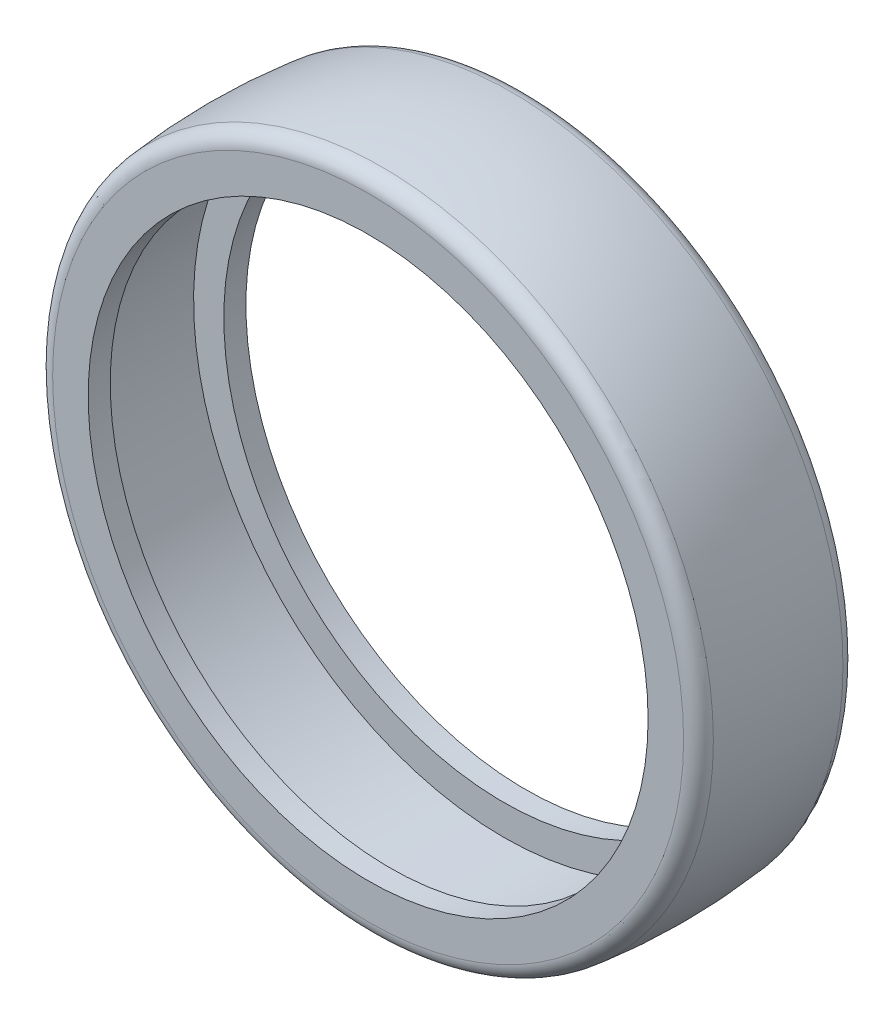
from build123d import *

# Parameters (mm, degrees)
FILLET1_R                = 1.5
SKETCH3_W                = 10.8
SKETCH3_H                = 2.875
REVOLVE2_ANGLE           = 10
REVOLVE2_OTHER_WAY_ANGLE = 10


with BuildPart() as part:
    # Sketch1 → Revolve1 (revolve)
    with BuildSketch(Plane(origin=(0, 0, 0), x_dir=(0, 0, -1), z_dir=(1, 0, 0))):
        Polygon((-6, 26.625), (-3.9, 26.625), (-3.9, 29.5), (6.9, 29.5), (6.9, 26.625), (9, 26.625), (9, 31.83), (-6, 31.83), align=None)
    revolve(axis=Axis((0, 0, 0), (0, 0, -1)))

    # Sketch2 → Cut-Revolve1 (revolve, cut)
    with BuildSketch(Plane(origin=(0, 0, 0), x_dir=(0, 0, -1), z_dir=(1, 0, 0))):
        with BuildLine():
            Line((-6, 34.232904199), (-6, 31.33))
            ThreePointArc((-6, 31.33), (1.5, 31.83), (9, 31.33))
            Line((9, 31.33), (9, 34.232904199))
            Line((9, 34.232904199), (-6, 34.232904199))
        make_face()
    revolve(axis=Axis((0, 0, 0), (0, 0, -1)), mode=Mode.SUBTRACT)

    # Fillet1
    fillet1_edges = [part.edges().sort_by_distance(p)[0] for p in [
        (0, -31.33, -9),
        (0, -31.33, 6),
    ]]
    fillet(fillet1_edges, radius=FILLET1_R)

    # Sketch3 → Revolve2 (revolve)
    with BuildSketch(Plane(origin=(0, 0, 0), x_dir=(0, 0, -1), z_dir=(1, 0, 0))):
        with Locations((1.5, 28.0625)):
            Rectangle(SKETCH3_W, SKETCH3_H)
    revolve(axis=Axis((0, 0, 0), (0, 0, -1)), revolution_arc=REVOLVE2_ANGLE)

    # Sketch3 → Revolve2 other way (revolve)
    with BuildSketch(Plane(origin=(0, 0, 0), x_dir=(0, 0, -1), z_dir=(1, 0, 0))):
        with Locations((1.5, 28.0625)):
            Rectangle(SKETCH3_W, SKETCH3_H)
    revolve(axis=Axis((0, 0, 0), (0, 0, 1)), revolution_arc=REVOLVE2_OTHER_WAY_ANGLE)


solid = part.part
